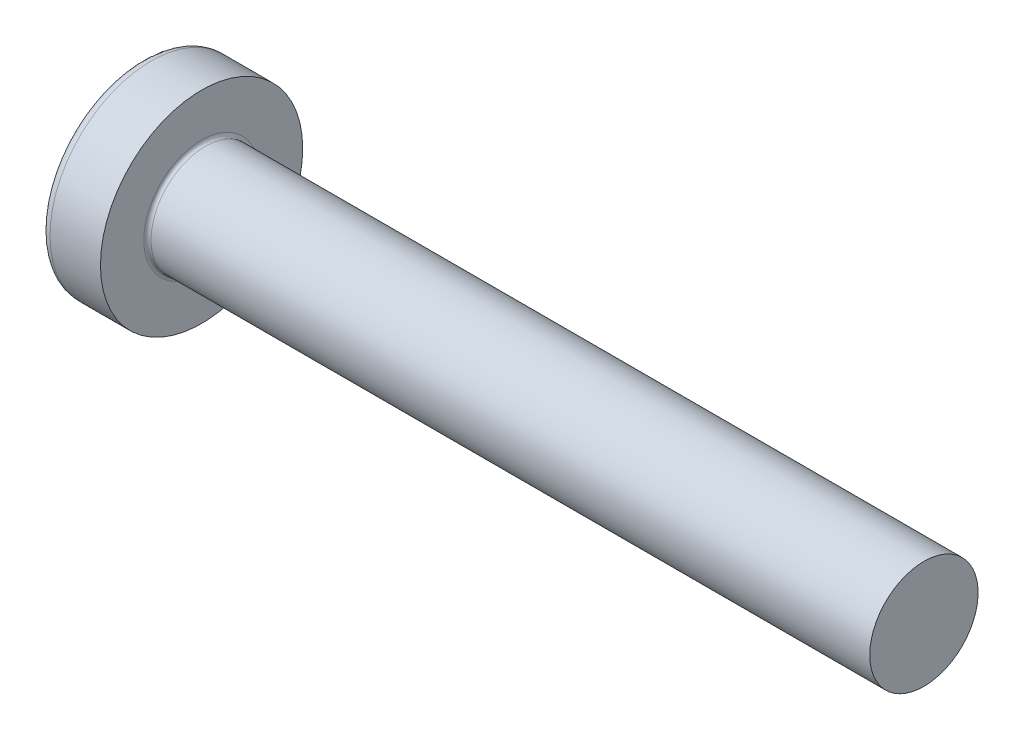
from build123d import *

# Parameters (mm, degrees)
RECPAT_COUNT = 2
RECPAT_ANGLE = 90


with BuildPart() as part:
    # Fillet1: read off the stored shape, not the designer's step
    # Fillet1 outline → Fillet1 (revolve)
    with BuildSketch(Plane.YX):
        with BuildLine():
            Line((1.5, 2.5), (1.5, 22.4))
            Line((1.5, 22.4), (0, 22.4))
            Line((0, 22.4), (0, 0))
            ThreePointArc((0, 0), (1.392274758, 0.197753547), (2.674418607, 0.775371601))
            ThreePointArc((2.674418607, 0.775371601), (2.76653015, 0.873295971), (2.8, 1.003501533))
            Line((2.8, 1.003501533), (2.8, 2.4))
            Line((2.8, 2.4), (1.6, 2.4))
            ThreePointArc((1.6, 2.4), (1.529289322, 2.429289322), (1.5, 2.5))
        make_face()
    revolve(axis=Axis((0, 0, 0), (1, 0, 0)))

    # Sketch3 → Recess section 0
    with BuildSketch(Plane(origin=(0, 0, 0), x_dir=(0, 0, -1), z_dir=(1, 0, 0))):
        with BuildLine():
            Line((0.37, -1.4), (-0.37, -1.4))
            Line((-0.37, -1.4), (-0.37, 1.4))
            Line((-0.37, 1.4), (0.37, 1.4))
            Line((0.37, 1.4), (0.37, -1.4))
        make_face()
    # Sketch4 → Recess section 1
    with BuildSketch(Plane(origin=(1.75, 0, 0), x_dir=(0, 0, -1), z_dir=(1, 0, 0))):
        with BuildLine():
            Line((0.37, -0.527482332), (-0.37, -0.527482332))
            Line((-0.37, -0.527482332), (-0.37, 0.527482332))
            Line((-0.37, 0.527482332), (0.37, 0.527482332))
            Line((0.37, 0.527482332), (0.37, -0.527482332))
        make_face()
    recess = loft(mode=Mode.SUBTRACT)

    # RecPat: Recess ×2 about axis
    recpat_axis = Axis((0, 0, 0), (1, 0, 0))
    for i in range(1, RECPAT_COUNT):
        add(recess.rotate(recpat_axis, i * RECPAT_ANGLE / (RECPAT_COUNT - 1)), mode=Mode.SUBTRACT)

    # RecCorSke → RecessCore (revolve, cut)
    with BuildSketch(Plane.XY, mode=Mode.PRIVATE) as recesscore_sk:
        Polygon((0, 0), (0, 0.678371921), (1.75, 0.556), (1.930655351, 0), align=None)
    revolve(recesscore_sk.sketch.rotate(Axis((-3.175, 0, 0), (1, 0, 0)), 90), axis=Axis((-3.175, 0, 0), (1, 0, 0)), mode=Mode.SUBTRACT)


solid = part.part
